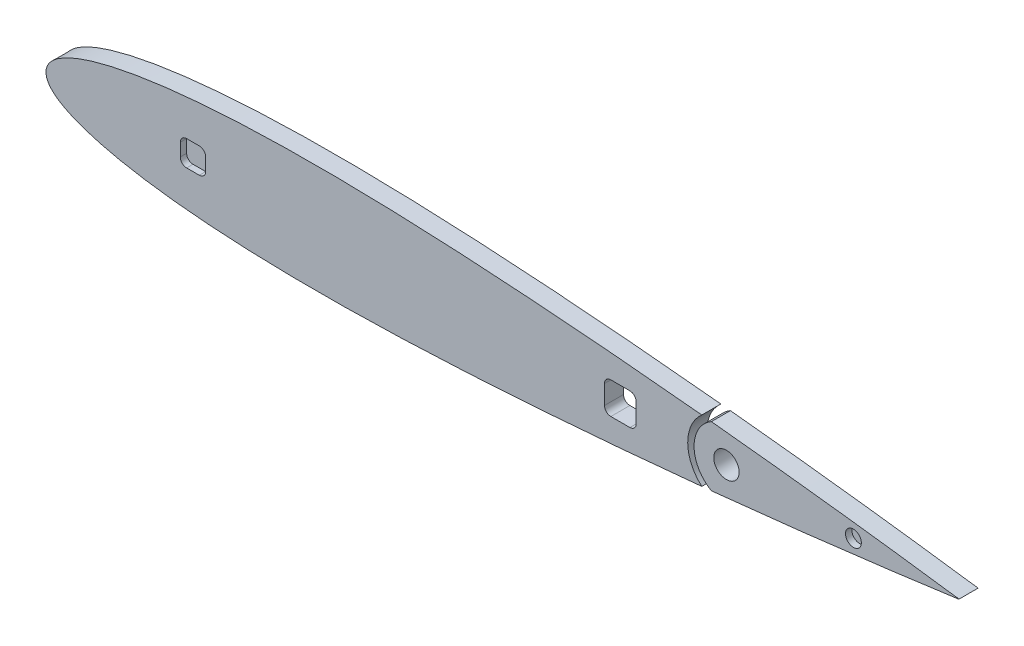
from build123d import *

# Parameters (mm, degrees)
RESSALTO_EXTRUS_O1_OUTLINE_R = 4
RESSALTO_EXTRUS_O1_DEPTH     = 6
CORTE_EXTRUS_O1_DEPTH        = 2
CORTE_EXTRUS_O2_DEPTH        = 2
ESBO_O5_R                    = 2.5
CORTE_EXTRUS_O3_DEPTH        = 2


# Read off the part's stored shape, not the designer's step: Ressalto-extrusão1
with BuildPart() as part:
    # Ressalto-extrusão1 outline → Ressalto-extrusão1 (new body)
    # profile 1 of 2: a face of its own
    with BuildSketch(Plane.XY):
        with BuildLine():
            add(Edge.make_bspline(
                [(206.59677672, 9.744047278), (206.292944708, 9.774653635), (203.907329388, 10.014434574), (199.39559532, 10.459873108), (193.021447659, 11.069962818), (186.529328525, 11.669700875), (179.934382421, 12.257126539), (173.252052511, 12.827383605), (166.497911298, 13.377921429), (159.687818769, 13.905224154), (152.837593287, 14.405058832), (145.963333172, 14.874290612), (139.081085422, 15.309171286), (132.20678029, 15.70550096), (125.35660044, 16.060145436), (118.546388357, 16.369233), (111.792105265, 16.629320446), (105.10962701, 16.837520337), (98.514511855, 16.990129218), (92.022156597, 17.084456768), (85.647566419, 17.117851746), (79.405754471, 17.088329774), (73.311328939, 16.994563536), (67.378571016, 16.833719315), (61.62120467, 16.606508882), (56.052663957, 16.311299689), (50.685913151, 15.948919147), (45.533589734, 15.519442809), (40.60767255, 15.02365128), (35.919607131, 14.463425319), (31.480201299, 13.841042083), (27.299913239, 13.157661743), (23.388323375, 12.416699746), (19.754434178, 11.620942186), (16.40673833, 10.773086642), (13.352633209, 9.876931334), (10.598853103, 8.935452398), (8.151270602, 7.951901503), (6.014730805, 6.929116001), (4.1933041, 5.869225283), (2.689111463, 4.774026072), (1.505059401, 3.641716827), (0.644003291, 2.469089904), (0.117552225, 1.250413641), (-0.057299877, 0), (0.117552225, -1.250413641), (0.644003291, -2.469089904), (1.505059401, -3.641716827), (2.689111463, -4.774026072), (4.1933041, -5.869225283), (6.014730805, -6.929116001), (8.151270602, -7.951901503), (10.598853103, -8.935452398), (13.352633209, -9.876931334), (16.40673833, -10.773086642), (19.754434178, -11.620942186), (23.388323375, -12.416699746), (27.299913239, -13.157661743), (31.480201299, -13.841042083), (35.919607131, -14.463425319), (40.60767255, -15.02365128), (45.533589734, -15.519442809), (50.685913151, -15.948919147), (56.052663957, -16.311299689), (61.62120467, -16.606508882), (67.378571016, -16.833719315), (73.311328939, -16.994563536), (79.405754471, -17.088329774), (85.647566419, -17.117851746), (92.022156597, -17.084456768), (98.514511855, -16.990129218), (105.10962701, -16.837520337), (111.792105265, -16.629320446), (118.546388357, -16.369233), (125.35660044, -16.060145436), (132.20678029, -15.70550096), (139.081085422, -15.309171286), (145.963333172, -14.874290612), (152.837593287, -14.405058832), (159.687818769, -13.905224154), (166.497911298, -13.377921429), (173.252052511, -12.827383605), (179.934382421, -12.257126539), (186.529328525, -11.669700875), (193.021447659, -11.069962818), (199.39559532, -10.459873108), (203.907329388, -10.014434574), (206.292944708, -9.774653635), (206.59677672, -9.744047278)],
                knots=[0.139138323, 0.139138323, 0.139138323, 0.139138323, 0.140700547, 0.151404252, 0.162331842, 0.173458675, 0.18475829, 0.196204076, 0.207768618, 0.219425945, 0.231147635, 0.242906359, 0.254675296, 0.26642621, 0.278132455, 0.289766477, 0.301301814, 0.312711646, 0.323969259, 0.33505005, 0.345928599, 0.356580621, 0.366981996, 0.377109776, 0.386942119, 0.396457905, 0.405636645, 0.41445907, 0.42290662, 0.430962851, 0.438611618, 0.445838275, 0.452630377, 0.458976173, 0.4648663, 0.470293868, 0.475254829, 0.479749124, 0.483781006, 0.48736258, 0.490515632, 0.493278566, 0.495712194, 0.497909944, 0.5, 0.502090056, 0.504287806, 0.506721434, 0.509484368, 0.51263742, 0.516218994, 0.520250876, 0.524745171, 0.529706132, 0.5351337, 0.541023827, 0.547369623, 0.554161725, 0.561388382, 0.569037149, 0.57709338, 0.58554093, 0.594363355, 0.603542095, 0.613057881, 0.622890224, 0.633018004, 0.643419379, 0.654071401, 0.66494995, 0.676030741, 0.687288354, 0.698698186, 0.710233523, 0.721867545, 0.73357379, 0.745324704, 0.757093641, 0.768852365, 0.780574055, 0.792231382, 0.803795924, 0.81524171, 0.826541325, 0.837668158, 0.848595748, 0.859299453, 0.860861677, 0.860861677, 0.860861677, 0.860861677], degree=3))
            ThreePointArc((206.59677672, -9.744047278), (202.150189054, 0), (206.59677672, 9.744047278))
        make_face()
        with BuildLine():
            Line((175.933333333, -3), (175.933333333, 3))
            ThreePointArc((175.933333333, 3), (176.519119771, 4.414213562), (177.933333333, 5))
            Line((177.933333333, 5), (183.933333333, 5))
            ThreePointArc((183.933333333, 5), (185.347546896, 4.414213563), (185.933333333, 3))
            Line((185.933333333, 3), (185.933333333, -3))
            ThreePointArc((185.933333333, -3), (185.347546896, -4.414213563), (183.933333333, -5))
            Line((183.933333333, -5), (177.933333333, -5))
            ThreePointArc((177.933333333, -5), (176.519119771, -4.414213562), (175.933333333, -3))
        make_face(mode=Mode.SUBTRACT)
    # profile 2 of 2: a face of its own
    with BuildSketch(Plane.XY):
        with BuildLine():
            ThreePointArc((209.6, 9.439349451), (204.150189054, 0), (209.6, -9.439349451))
            add(Edge.make_bspline(
                [(209.6, -9.439349451), (210.32804405, -9.364968071), (213.035379881, -9.087000325), (217.663214551, -8.603508067), (223.419943837, -7.985483384), (228.987863488, -7.373628638), (234.353792881, -6.769587119), (239.5053681, -6.177691953), (244.430264247, -5.599454736), (249.117159969, -5.038339365), (253.555140371, -4.49727783), (257.733807871, -3.97868529), (261.643364865, -3.485243955), (265.274709704, -3.020406095), (268.619301696, -2.585347237), (271.669401999, -2.183559584), (274.417893217, -1.816930381), (276.858420544, -1.488091926), (278.98510147, -1.198450267), (280.793202236, -0.949881536), (282.277829485, -0.74507406), (283.43768813, -0.583773245), (284.264448894, -0.467820009), (284.767865992, -0.398094711), (285.817754553, -0.247185692), (287.6, -0.119697914), (287.6, 0), (287.6, 0.119697914), (285.817754553, 0.247185692), (284.767865992, 0.398094711), (284.264448894, 0.467820009), (283.43768813, 0.583773245), (282.277829485, 0.74507406), (280.793202236, 0.949881536), (278.98510147, 1.198450267), (276.858420544, 1.488091926), (274.417893217, 1.816930381), (271.669401999, 2.183559584), (268.619301696, 2.585347237), (265.274709704, 3.020406095), (261.643364865, 3.485243955), (257.733807871, 3.97868529), (253.555140371, 4.49727783), (249.117159969, 5.038339365), (244.430264247, 5.599454736), (239.5053681, 6.177691953), (234.353792881, 6.769587119), (228.987863488, 7.373628638), (223.419943837, 7.985483384), (217.663214551, 8.603508067), (213.035379881, 9.087000325), (210.32804405, 9.364968071), (209.6, 9.439349451)],
                knots=[0.866009309, 0.866009309, 0.866009309, 0.866009309, 0.869753257, 0.879932425, 0.889813425, 0.899372991, 0.908588481, 0.917438048, 0.925901016, 0.933956533, 0.941586686, 0.948773131, 0.955497933, 0.961746042, 0.967502103, 0.972752493, 0.97748467, 0.981687532, 0.98535058, 0.988465174, 0.99102363, 0.99302004, 0.994449737, 0.995308668, 0.995595321, 1, 1, 1, 1.004404679, 1.004691332, 1.005550263, 1.00697996, 1.00897637, 1.011534826, 1.01464942, 1.018312468, 1.02251533, 1.027247507, 1.032497897, 1.038253958, 1.044502067, 1.051226869, 1.058413314, 1.066043467, 1.074098984, 1.082561952, 1.091411519, 1.100627009, 1.110186575, 1.120067575, 1.130246743, 1.133990691, 1.133990691, 1.133990691, 1.133990691], degree=3))
        make_face()
        with Locations((214.35, 0)):
            Circle(RESSALTO_EXTRUS_O1_OUTLINE_R, mode=Mode.SUBTRACT)
    extrude(amount=RESSALTO_EXTRUS_O1_DEPTH)

    # Esboço3 → Corte-extrusão1 (cut)
    with BuildSketch(Plane(origin=(0, 0, 0), x_dir=(-1, 0, 0), z_dir=(0, 0, -1))):
        with BuildLine():
            Line((-13, -4), (-17, -4))
            ThreePointArc((-17, -4), (-18.414213562, -3.414213562), (-19, -2))
            Line((-19, -2), (-19, 2))
            ThreePointArc((-19, 2), (-18.414213562, 3.414213562), (-17, 4))
            Line((-17, 4), (-13, 4))
            ThreePointArc((-13, 4), (-11.585786438, 3.414213562), (-11, 2))
            Line((-11, 2), (-11, -2))
            ThreePointArc((-11, -2), (-11.585786438, -3.414213562), (-13, -4))
        make_face()
    extrude(amount=-CORTE_EXTRUS_O1_DEPTH, mode=Mode.SUBTRACT)

    # Esboço4 → Corte-extrusão2 (cut)
    with BuildSketch(Plane.XY.offset(6)):
        with BuildLine():
            Line((44.3, -4), (48.3, -4))
            ThreePointArc((48.3, -4), (49.714213562, -3.414213562), (50.3, -2))
            Line((50.3, -2), (50.3, 2))
            ThreePointArc((50.3, 2), (49.714213562, 3.414213562), (48.3, 4))
            Line((48.3, 4), (44.3, 4))
            ThreePointArc((44.3, 4), (42.885786438, 3.414213562), (42.3, 2))
            Line((42.3, 2), (42.3, -2))
            ThreePointArc((42.3, -2), (42.885786438, -3.414213562), (44.3, -4))
        make_face()
    extrude(amount=-CORTE_EXTRUS_O2_DEPTH, mode=Mode.SUBTRACT)

    # Esboço5 → Corte-extrusão3 (cut)
    with BuildSketch(Plane.XY.offset(6)):
        with Locations((254.35, 0)):
            Circle(ESBO_O5_R)
    extrude(amount=-CORTE_EXTRUS_O3_DEPTH, mode=Mode.SUBTRACT)


solid = part.part
